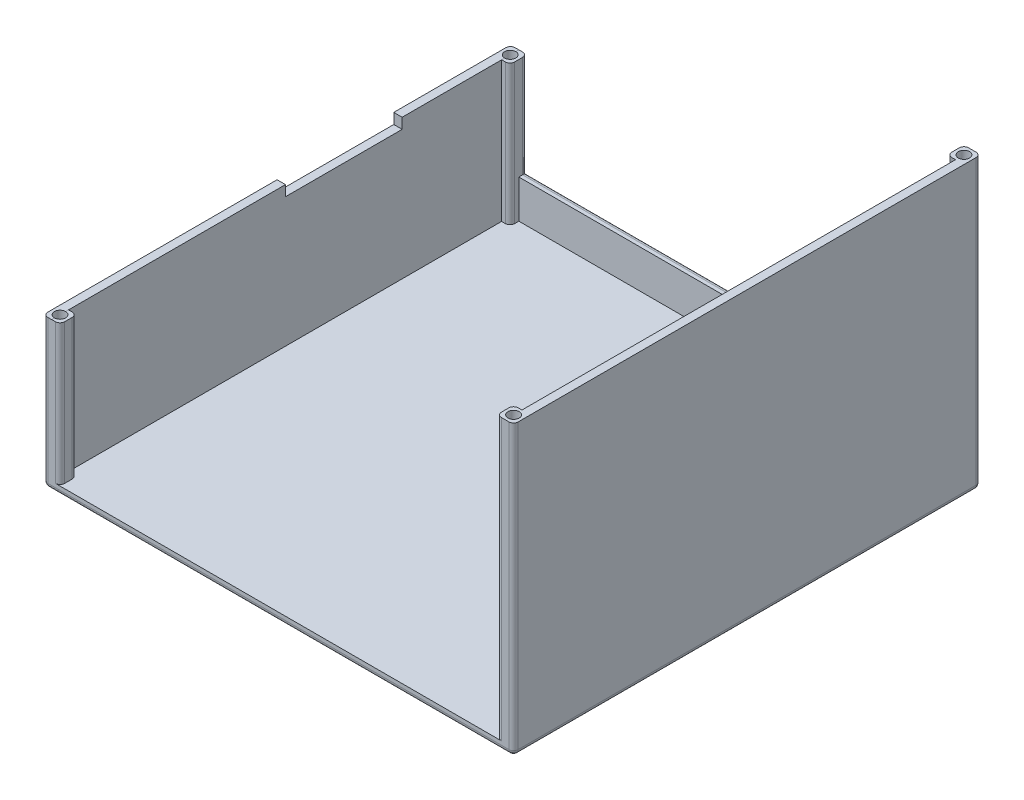
from build123d import *

# Parameters (mm, degrees)
SKETCH1_W                = 127.979014886
SKETCH1_H                = 127.125142163
BOSS_EXTRUDE1_DEPTH      = 2.286
SKETCH2_W                = 127.979014886
SKETCH2_H                = 127.125142163
BOSS_EXTRUDE2_DEPTH      = 76.2
SKETCH4_W                = 123.407014886
SKETCH4_H                = 122.553142163
CUT_EXTRUDE2_DEPTH       = 76.2
SKETCH5_W                = 123.407014886
SKETCH5_H                = 76.2
CUT_EXTRUDE3_DEPTH       = 2.286
SKETCH6_W                = 123.407014886
SKETCH6_H                = 65.786
CUT_EXTRUDE4_DEPTH       = 2.286
SKETCH7_W                = 127.125142163
SKETCH7_H                = 38.112983868
CUT_EXTRUDE5_DEPTH       = 2.286
SKETCH8_W                = 31.75
SKETCH8_H                = 2.854777597
CUT_EXTRUDE6_DEPTH       = 2.54
SKETCH9_W                = 2.286
SKETCH9_H                = 4.572
BOSS_EXTRUDE3_DEPTH      = 76.2
SKETCH11_W               = 2.286
SKETCH11_H               = 4.572
BOSS_EXTRUDE5_DEPTH      = 38.1
BOSS_EXTRUDE6_DEPTH      = 27.686
BOSS_EXTRUDE6_DEPTH_BACK = 10.414
SKETCH12_W               = 2.286
SKETCH12_H               = 4.697142163
BOSS_EXTRUDE7_DEPTH      = 65.786
BOSS_EXTRUDE7_DEPTH_BACK = 10.414
SKETCH13_W               = 2.286
SKETCH13_H               = 4.572
SKETCH14_R               = 1.524
CUT_EXTRUDE7_DEPTH       = 6.35
SKETCH15_R               = 1.524
CUT_EXTRUDE8_DEPTH       = 6.35
SKETCH16_R               = 1.524
CUT_EXTRUDE9_DEPTH       = 6.35
SKETCH18_R               = 1.524
CUT_EXTRUDE10_DEPTH      = 6.35
SKETCH19_R               = 1.524
CUT_EXTRUDE11_DEPTH      = 6.35
FILLET1_R                = 1.27
FILLET2_R                = 1.27
FILLET7_R                = 1.27
FILLET8_R                = 1.27


with BuildPart() as part:
    # Sketch1 → Boss-Extrude1 (new body)
    with BuildSketch(Plane(origin=(0, 0, 0), x_dir=(1, 0, 0), z_dir=(0, 1, 0))):
        with Locations((63.989507443, 63.562571082)):
            Rectangle(SKETCH1_W, SKETCH1_H)
    extrude(amount=BOSS_EXTRUDE1_DEPTH)

    # Sketch2 → Boss-Extrude2 (add)
    with BuildSketch(Plane(origin=(0, 2.286, 0), x_dir=(1, 0, 0), z_dir=(0, 1, 0))):
        with Locations((63.989507443, 63.562571082)):
            Rectangle(SKETCH2_W, SKETCH2_H)
    extrude(amount=BOSS_EXTRUDE2_DEPTH)

    # Sketch4 → Cut-Extrude2 (cut)
    with BuildSketch(Plane(origin=(0, 78.486, 0), x_dir=(1, 0, 0), z_dir=(0, 1, 0))):
        with Locations((63.989507443, 63.562571082)):
            Rectangle(SKETCH4_W, SKETCH4_H)
    extrude(amount=-CUT_EXTRUDE2_DEPTH, mode=Mode.SUBTRACT)

    # Sketch5 → Cut-Extrude3 (cut)
    with BuildSketch(Plane.XY):
        with Locations((63.989507443, 40.386)):
            Rectangle(SKETCH5_W, SKETCH5_H)
    extrude(amount=-CUT_EXTRUDE3_DEPTH, mode=Mode.SUBTRACT)

    # Sketch6 → Cut-Extrude4 (cut)
    with BuildSketch(Plane(origin=(0, 0, -127.125142163), x_dir=(-1, 0, 0), z_dir=(0, 0, -1))):
        with Locations((-63.989507443, 45.593)):
            Rectangle(SKETCH6_W, SKETCH6_H)
    extrude(amount=-CUT_EXTRUDE4_DEPTH, mode=Mode.SUBTRACT)

    # Sketch7 → Cut-Extrude5 (cut)
    with BuildSketch(Plane.ZY):
        with Locations((-63.562571082, 59.429508066)):
            Rectangle(SKETCH7_W, SKETCH7_H)
    extrude(amount=-CUT_EXTRUDE5_DEPTH, mode=Mode.SUBTRACT)

    # Sketch8 → Cut-Extrude6 (cut)
    with BuildSketch(Plane.ZY):
        with Locations((-79.500142163, 38.945627333)):
            Rectangle(SKETCH8_W, SKETCH8_H)
    extrude(amount=-CUT_EXTRUDE6_DEPTH, mode=Mode.SUBTRACT)

    # Sketch9 → Boss-Extrude3 (add)
    with BuildSketch(Plane(origin=(0, 2.286, 0), x_dir=(1, 0, 0), z_dir=(0, 1, 0))):
        with Locations((124.550014886, 2.286)):
            Rectangle(SKETCH9_W, SKETCH9_H)
    extrude(amount=BOSS_EXTRUDE3_DEPTH)

    # Sketch11 → Boss-Extrude5 (add)
    with BuildSketch(Plane(origin=(0, 2.286, 0), x_dir=(1, 0, 0), z_dir=(0, 1, 0))):
        with Locations((3.429, 2.286)):
            Rectangle(SKETCH11_W, SKETCH11_H)
    extrude(amount=BOSS_EXTRUDE5_DEPTH)

    # Sketch12 → Boss-Extrude6 (add, two sides: drawn at the far end of the back side and taken through both)
    with BuildSketch(Plane(origin=(0, 12.7, 0), x_dir=(1, 0, 0), z_dir=(0, 1, 0)).offset(-BOSS_EXTRUDE6_DEPTH_BACK)):
        with Locations((3.429, 124.776571082)):
            Rectangle(SKETCH12_W, SKETCH12_H)
    extrude(amount=BOSS_EXTRUDE6_DEPTH + BOSS_EXTRUDE6_DEPTH_BACK)

    # Sketch13 → Boss-Extrude7 (add, two sides: drawn at the far end of the back side and taken through both)
    with BuildSketch(Plane(origin=(0, 12.7, 0), x_dir=(1, 0, 0), z_dir=(0, 1, 0)).offset(-BOSS_EXTRUDE7_DEPTH_BACK)):
        with Locations((124.550014886, 124.839142163)):
            Rectangle(SKETCH13_W, SKETCH13_H)
    extrude(amount=BOSS_EXTRUDE7_DEPTH + BOSS_EXTRUDE7_DEPTH_BACK)

    # Sketch14 → Cut-Extrude7 (cut)
    with BuildSketch(Plane(origin=(0, 78.486, 0), x_dir=(1, 0, 0), z_dir=(0, 1, 0))):
        with Locations(Location((125.693014886, 2.286, 0), (0, 0, 270))):
            Circle(SKETCH14_R)
    extrude(amount=-CUT_EXTRUDE7_DEPTH, mode=Mode.SUBTRACT)

    # Sketch15 → Cut-Extrude8 (cut)
    with BuildSketch(Plane(origin=(0, 78.486, 0), x_dir=(1, 0, 0), z_dir=(0, 1, 0))):
        with Locations(Location((125.693014886, 124.839142163, 0), (0, 0, 270))):
            Circle(SKETCH15_R)
    extrude(amount=-CUT_EXTRUDE8_DEPTH, mode=Mode.SUBTRACT)

    # Sketch16 → Cut-Extrude9 (cut)
    with BuildSketch(Plane(origin=(0, 40.373016132, 0), x_dir=(1, 0, 0), z_dir=(0, 1, 0))):
        with Locations(Location((2.286, 2.286, 0), (0, 0, 270))):
            Circle(SKETCH16_R)
    extrude(amount=-CUT_EXTRUDE9_DEPTH, mode=Mode.SUBTRACT)

    # Sketch18 → Cut-Extrude10 (cut)
    with BuildSketch(Plane(origin=(0, 40.386, 0), x_dir=(1, 0, 0), z_dir=(0, 1, 0))):
        with Locations(Location((2.286, 2.286, 0), (0, 0, 270))):
            Circle(SKETCH18_R)
    extrude(amount=-CUT_EXTRUDE10_DEPTH, mode=Mode.SUBTRACT)

    # Sketch19 → Cut-Extrude11 (cut)
    with BuildSketch(Plane(origin=(0, 40.386, 0), x_dir=(1, 0, 0), z_dir=(0, 1, 0))):
        with Locations(Location((2.286, 124.776571082, 0), (0, 0, 270))):
            Circle(SKETCH19_R)
    extrude(amount=-CUT_EXTRUDE11_DEPTH, mode=Mode.SUBTRACT)

    # Fillet1
    fillet1_edges = [part.edges().sort_by_distance(p)[0] for p in [
        (0, 20.186508066, 0),
    ]]
    fillet(fillet1_edges, radius=FILLET1_R)

    # Fillet2
    fillet2_edges = [part.edges().sort_by_distance(p)[0] for p in [
        (4.572, 21.336, 0),
        (4.572, 21.336, -4.572),
        (4.572, 26.543, -127.125142163),
        (63.989507443, 12.7, -127.125142163),
        (123.407014886, 45.593, -127.125142163),
        (64.624507443, 0, 0),
        (0, 0, -64.197571082),
        (0.371974388, 0, -0.371974388),
        (127.979014886, 0, -63.562571082),
        (63.989507443, 0, -127.125142163),
        (0, 20.186508066, -127.125142163),
        (127.979014886, 39.243, -127.125142163),
    ]]
    fillet(fillet2_edges, radius=FILLET2_R)

    # Fillet7
    fillet7_edges = [part.edges().sort_by_distance(p)[0] for p in [
        (4.572, 21.336, -122.428),
    ]]
    fillet(fillet7_edges, radius=FILLET7_R)

    # Fillet8
    # the kernel refuses this fillet: 1.27 mm, written as the material it takes off along each edge
    with BuildSketch(Plane(origin=(126.709014886, 1.27, -1.27), x_dir=(1, 0, 0), z_dir=(0, 0, 1))) as fillet8_piece_1_section:
        Polygon((0, 0), (FILLET8_R, 0), (FILLET8_R, -FILLET8_R), (0, -FILLET8_R), align=None)
    fillet8_piece_1 = extrude(amount=FILLET8_R, mode=Mode.PRIVATE)
    fillet8_piece_1 = fillet8_piece_1 - Plane(origin=(126.709014886, 1.27, -1.27), x_dir=(-0.7071067811865475, 0.7071067811865475, 0), z_dir=(0, 0, 1)) * Sphere(FILLET8_R, mode=Mode.PRIVATE)
    add(fillet8_piece_1, mode=Mode.SUBTRACT)
    with BuildSketch(Plane(origin=(123.407014886, 2.286, -4.572), x_dir=(1, 0, 0), z_dir=(0, 1, 0)), Plane(origin=(123.407014886, 2.286, 0), x_dir=(0, 0, -1), z_dir=(0, 1, 0)), Plane(origin=(123.407014886, 2.286, -122.553142163), x_dir=(0, 0, -1), z_dir=(0, 1, 0))) as fillet8_piece_2:
        with BuildLine():
            CenterArc((FILLET8_R, -FILLET8_R), FILLET8_R, 90, 90)
            Line((0, -FILLET8_R), (0, 0))
            Line((0, 0), (FILLET8_R, 0))
        make_face()
    extrude(amount=79.375, mode=Mode.SUBTRACT)
    with BuildSketch(Plane(origin=(127.979014886, 1.27, 0), x_dir=(-1, 0, 0), z_dir=(0, 1, 0))) as fillet8_piece_3:
        with BuildLine():
            CenterArc((FILLET8_R, -FILLET8_R), FILLET8_R, 90, 90)
            Line((0, -FILLET8_R), (0, 0))
            Line((0, 0), (FILLET8_R, 0))
        make_face()
    extrude(amount=80.391, mode=Mode.SUBTRACT)


solid = part.part
